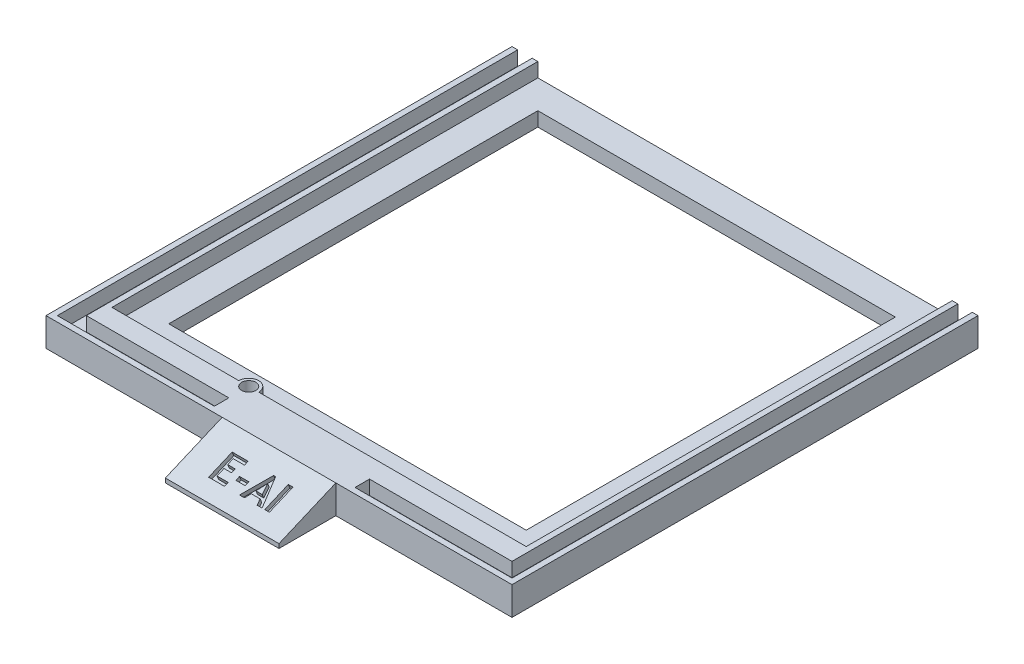
from build123d import *

# Parameters (mm, degrees)
SKETCH1_W           = 164
SKETCH1_H           = 164
BOSS_EXTRUDE1_DEPTH = 5
BOSS_EXTRUDE2_DEPTH = 5
SKETCH3_R           = 3.5
SKETCH3_R_2         = 2.5
BOSS_EXTRUDE3_DEPTH = 5
SKETCH5_W           = 125.8
SKETCH5_H           = 129.9
CUT_EXTRUDE1_DEPTH  = 117.073252733
CHAMFER2_SIZE       = 10
BOSS_EXTRUDE4_DEPTH = 20
SKETCH7_W           = 3.272727273
SKETCH7_H           = 1.402597403
SKETCH7_W_2         = 1.636363636
SKETCH7_H_2         = 9
CUT_EXTRUDE3_DEPTH  = 1.5


with BuildPart() as part:
    # Sketch1 → Boss-Extrude1 (new body)
    with BuildSketch(Plane(origin=(0, 0, 0), x_dir=(1, 0, 0), z_dir=(0, 1, 0))):
        Rectangle(SKETCH1_W, SKETCH1_H)
    extrude(amount=BOSS_EXTRUDE1_DEPTH)

    # Sketch2 → Boss-Extrude2 (add)
    with BuildSketch(Plane(origin=(0, 5, 0), x_dir=(1, 0, 0), z_dir=(0, 1, 0))):
        Polygon((-80, -80), (-80, 82), (-82, 82), (-82, -82), (82, -82), (82, 82), (80, 82), (80, -80), (24.75, -80), (24.75, -74.9), (74.9, -74.9), (74.9, 82), (72.9, 82), (72.9, -72.9), (-72.9, -72.9), (-72.9, 82), (-74.9, 82), (-74.9, -74.9), (-24.75, -74.9), (-24.75, -80), align=None)
    extrude(amount=BOSS_EXTRUDE2_DEPTH)

    # Sketch3 → Boss-Extrude3 (add)
    with BuildSketch(Plane(origin=(0, 5, 0), x_dir=(1, 0, 0), z_dir=(0, 1, 0))):
        with Locations(Location((-24.75, -67.9, 0), (0, 0, 270))):
            Circle(SKETCH3_R)
        with Locations(Location((-24.75, -67.9, 0), (0, 0, 270))):
            Circle(SKETCH3_R_2, mode=Mode.SUBTRACT)
    extrude(amount=BOSS_EXTRUDE3_DEPTH)

    # Sketch5 → Cut-Extrude1 (cut, through all)
    with BuildSketch(Plane(origin=(0, 5, 0), x_dir=(1, 0, 0), z_dir=(0, 1, 0))):
        with Locations((0, 7.05)):
            Rectangle(SKETCH5_W, SKETCH5_H)
    extrude(amount=-CUT_EXTRUDE1_DEPTH, mode=Mode.SUBTRACT)

    # Chamfer2
    # the kernel refuses this chamfer: 10 mm, written as the material it adds along each edge
    with BuildSketch(Plane(origin=(98.61682988, 5, 72.9), x_dir=(0, -0.027495876610586403, -0.9996219169112968), z_dir=(-1, 0, 0))) as chamfer2_piece_1_section:
        Polygon((CHAMFER2_SIZE * 0.999621916911, -CHAMFER2_SIZE * 0.0274958766106), (-CHAMFER2_SIZE * 0.0274958766106, -CHAMFER2_SIZE * 0.999621916911), (0, 0), align=None)
    chamfer2_piece_1 = extrude(amount=171.51682988, mode=Mode.PRIVATE)
    chamfer2_piece_1 = split(chamfer2_piece_1, bisect_by=Plane(origin=(0.76457013, 10, 69.034324166), z_dir=(0, -1, 0)), keep=Keep.TOP, mode=Mode.PRIVATE)
    chamfer2_piece_1 = split(chamfer2_piece_1, bisect_by=Plane(origin=(74.9, 7.221559046, 69.034324166), z_dir=(-1, 0, 0)), keep=Keep.TOP, mode=Mode.PRIVATE)
    chamfer2_piece_1 = chamfer2_piece_1 - Plane(origin=(-24.75, 7.221559046, 67.9), x_dir=(0, 0, 1), z_dir=(0, -1, 0)) * Cylinder(2.5, 384, mode=Mode.PRIVATE)
    add(chamfer2_piece_1)

    # Sketch6 → Boss-Extrude4 (add, symmetric)
    with BuildSketch(Plane(origin=(0, 0, 0), x_dir=(0, 0, -1), z_dir=(1, 0, 0))):
        Polygon((-82, 0), (-82, 10), (-102, 1.5), (-102, 0), align=None)
    extrude(amount=BOSS_EXTRUDE4_DEPTH, both=True)

    # Sketch7 → Cut-Extrude3 (cut)
    # profile 1 of 4: a face of its own
    with BuildSketch(Plane(origin=(0, -16.938205466, 145.38401286), x_dir=(1, 0, 0), z_dir=(0, -0.9203309184584746, -0.39114064034485163))):
        Polygon((-8.649350649, -60.736982492), (-8.649350649, -58.633086388), (-5.961038961, -58.633086388), (-5.961038961, -57.230488986), (-8.649350649, -57.230488986), (-8.649350649, -54.542177297), (-4.675324675, -54.542177297), (-4.675324675, -53.139579895), (-10.285714286, -53.139579895), (-10.285714286, -62.139579895), (-4.675324675, -62.139579895), (-4.675324675, -60.736982492), align=None)
    # profile 2 of 4: a face of its own
    with BuildSketch(Plane(origin=(0, -16.938205466, 145.38401286), x_dir=(1, 0, 0), z_dir=(0, -0.9203309184584746, -0.39114064034485163))):
        with Locations((-1.753246754, -56.762956519)):
            Rectangle(SKETCH7_W, SKETCH7_H)
    # profile 3 of 4: a face of its own
    with BuildSketch(Plane(origin=(0, -16.938205466, 145.38401286), x_dir=(1, 0, 0), z_dir=(0, -0.9203309184584746, -0.39114064034485163))):
        Polygon((6.779220779, -53.139579895), (6.118100649, -55.009709765), (2.978693182, -55.009709765), (2.337662338, -53.139579895), (0.584415584, -53.139579895), (4.207792208, -62.256463012), (4.909090909, -62.256463012), (8.532467532, -53.139579895), align=None)
        Polygon((4.558441558, -59.568151323), (3.444399351, -56.295424051), (5.648741883, -56.295424051), align=None, mode=Mode.SUBTRACT)
    # profile 4 of 4: a face of its own
    with BuildSketch(Plane(origin=(0, -16.938205466, 145.38401286), x_dir=(1, 0, 0), z_dir=(0, -0.9203309184584746, -0.39114064034485163))):
        with Locations((10.285714286, -57.639579895)):
            Rectangle(SKETCH7_W_2, SKETCH7_H_2)
    extrude(amount=CUT_EXTRUDE3_DEPTH, mode=Mode.SUBTRACT)


solid = part.part
